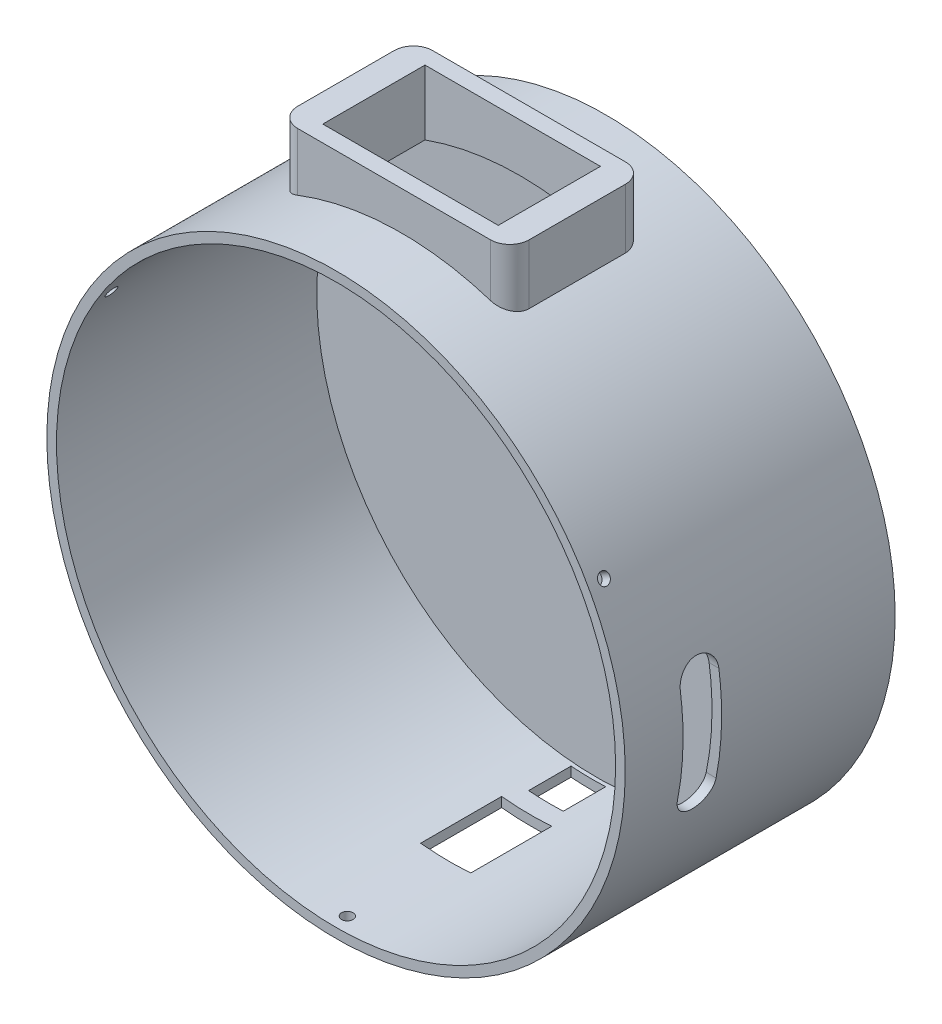
from build123d import *

# Parameters (mm, degrees)
SZKIC1_R                    = 75
DODANIE_WYCI_GNI_CIE1_DEPTH = 70
SKORUPA1_T                  = -2.5
SZKIC3_W                    = 13
SZKIC3_H                    = 21
WYTNIJ_WYCI_GNI_CIE1_DEPTH  = 60
SZKIC4_W                    = 9
SZKIC4_H                    = 11
WYTNIJ_WYCI_GNI_CIE2_DEPTH  = 60
SZKIC5_R                    = 1.5
WYTNIJ_WYCI_GNI_CIE3_DEPTH  = 60
SZYK_KO_OWY1_COUNT          = 3
DODANIE_WYCI_GNI_CIE2_REACH = 192.066
SZKIC7_W                    = 60
SZKIC7_H                    = 35
SZKIC8_W                    = 45.5
SZKIC8_H                    = 26.5
WYTNIJ_WYCI_GNI_CIE4_DEPTH  = 30
ZAOKR_GLENIE1_R             = 5
WYTNIJ_WYCI_GNI_CIE5_DEPTH  = 14


with BuildPart() as part:
    # Szkic1 → Dodanie-wyciągnięcie1 (new body)
    with BuildSketch(Plane.XY):
        Circle(SZKIC1_R)
    extrude(amount=DODANIE_WYCI_GNI_CIE1_DEPTH)

    # Skorupa1
    skorupa1_openings = [part.faces().sort_by_distance(p)[0] for p in [
        (0, 0, 70),
    ]]
    offset(amount=SKORUPA1_T, openings=skorupa1_openings, kind=Kind.INTERSECTION)

    # Szkic3 → Wytnij-wyciągnięcie1 (cut)
    with BuildSketch(Plane(origin=(0, -75, 0), x_dir=(-1, 0, 0), z_dir=(0, -1, 0))):
        with Locations((1.061442615, -30)):
            Rectangle(SZKIC3_W, SZKIC3_H)
    extrude(amount=-WYTNIJ_WYCI_GNI_CIE1_DEPTH, mode=Mode.SUBTRACT)

    # Szkic4 → Wytnij-wyciągnięcie2 (cut)
    with BuildSketch(Plane(origin=(0, -75, 0), x_dir=(-1, 0, 0), z_dir=(0, -1, 0))):
        with Locations((1.061442615, -9)):
            Rectangle(SZKIC4_W, SZKIC4_H)
    extrude(amount=-WYTNIJ_WYCI_GNI_CIE2_DEPTH, mode=Mode.SUBTRACT)

    # Szkic5 → Wytnij-wyciągnięcie3 (cut)
    with BuildSketch(Plane(origin=(0, -75, 0), x_dir=(-1, 0, 0), z_dir=(0, -1, 0))):
        with Locations((1.061442615, -66)):
            Circle(SZKIC5_R)
    wytnij_wyci_gni_cie3 = extrude(amount=-WYTNIJ_WYCI_GNI_CIE3_DEPTH, mode=Mode.SUBTRACT)

    # Szyk kołowy1: Wytnij-wyciągnięcie3 ×3 about axis
    szyk_ko_owy1_axis = Axis((0, 0, 70), (0, 0, 1))
    for i in range(1, SZYK_KO_OWY1_COUNT):
        add(wytnij_wyci_gni_cie3.rotate(szyk_ko_owy1_axis, i * 360 / SZYK_KO_OWY1_COUNT), mode=Mode.SUBTRACT)

    # Szkic7 → Dodanie-wyciągnięcie2 (add, up to next)
    with BuildSketch(Plane(origin=(0, 85, 0), x_dir=(-1, 0, 0), z_dir=(0, -1, 0)), mode=Mode.PRIVATE) as dodanie_wyci_gni_cie2_sk1:
        with Locations((1.900639924, -35.532003496)):
            Rectangle(SZKIC7_W, SZKIC7_H)
    dodanie_wyci_gni_cie2_tool1 = extrude(dodanie_wyci_gni_cie2_sk1.sketch, amount=DODANIE_WYCI_GNI_CIE2_REACH, mode=Mode.PRIVATE) - part.part
    add(dodanie_wyci_gni_cie2_tool1.solids().sort_by_distance((-1.90064, 85, 35.532003))[0])

    # Szkic8 → Wytnij-wyciągnięcie4 (cut)
    with BuildSketch(Plane(origin=(0, 85, 0), x_dir=(1, 0, 0), z_dir=(0, 1, 0))):
        with Locations((-1.900639924, -35.532003496)):
            Rectangle(SZKIC8_W, SZKIC8_H)
    extrude(amount=-WYTNIJ_WYCI_GNI_CIE4_DEPTH, mode=Mode.SUBTRACT)

    # Zaokrąglenie1
    zaokr_glenie1_edges = [part.edges().sort_by_distance(p)[0] for p in [
        (28.099360076, 77.268613588, 53.032003496),
        (28.099360076, 77.268613588, 18.032003496),
        (-31.900639924, 76.438728514, 53.032003496),
        (-31.900639924, 76.438728514, 18.032003496),
    ]]
    fillet(zaokr_glenie1_edges, radius=ZAOKR_GLENIE1_R)

    # Szkic9 → Wytnij-wyciągnięcie5 (cut)
    with BuildSketch(Plane(origin=(74.980282386, -1.719666633, 0), x_dir=(0, 0, -1), z_dir=(0.9997370984787233, -0.022928888445450712, 0))):
        with BuildLine():
            Line((-55, -12.979686846), (-55, 12.020313154))
            ThreePointArc((-55, 12.020313154), (-50, 17.020313154), (-45, 12.020313154))
            Line((-45, 12.020313154), (-45, -12.979686846))
            ThreePointArc((-45, -12.979686846), (-50, -17.979686846), (-55, -12.979686846))
        make_face()
    extrude(amount=-WYTNIJ_WYCI_GNI_CIE5_DEPTH, mode=Mode.SUBTRACT)


solid = part.part
